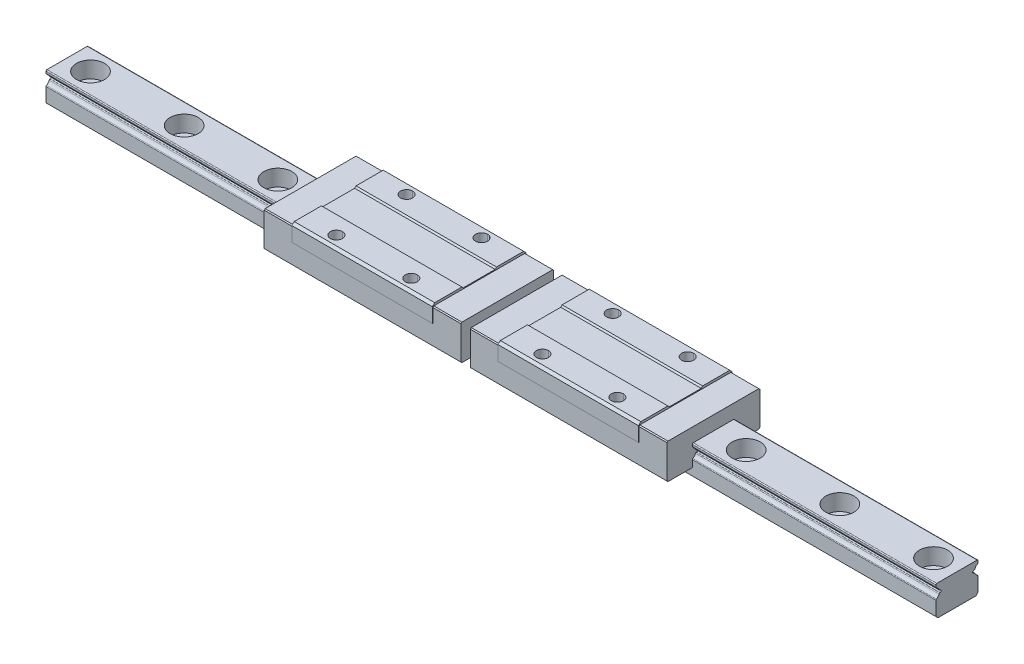
from build123d import *

# Parameters (mm, degrees)
SKETCH_1_W                   = 190
SKETCH_1_H                   = 9
EXTRUDE_1_DEPTH              = 6.5
CUT_EXTRUDE_1_DEPTH          = 191.081068231
CUT_EXTRUDE_2_DEPTH          = 191.081068231
CUT_EXTRUDE_3_DEPTH          = 191.081068231
CUT_EXTRUDE_4_DEPTH          = 191.081068231
CUT_EXTRUDE_5_DEPTH          = 191.081068231
CUT_EXTRUDE_6_DEPTH          = 191.081068231
HOLE_WIZARD_M3_1_D           = 3.5
HOLE_WIZARD_M3_1_CBORE_D     = 5.9999
HOLE_WIZARD_M3_1_CBORE_DEPTH = 3.5
CHAMFER_1_SIZE               = 0.45
FILLET_1_R                   = 0.2
MOVE_START                   = -28.71
MOVE_BODY_1_DEPTH            = 13.42
MOVE_START_2                 = -43
MOVE_BODY_1_2_DEPTH          = 11.71
MOVE_START_3                 = -12.71
MOVE_BODY_1_3_DEPTH          = 11.71
MOVE_START_4                 = -37
MOVE_BODY_1_4_DEPTH          = 5.71
MOVE_BODY_1_5_DEPTH          = 5.71
MOVE_BODY_1_6_DEPTH          = 30
MOVE_START_5                 = -31.29
MOVE_BODY_1_7_DEPTH          = 18.58


with BuildPart() as part:
    # 草图1 → 凸台-拉伸1 (new body)
    with BuildSketch(Plane(origin=(0, 3.25, 0), x_dir=(1, 0, 0), z_dir=(0, 1, 0))):
        Rectangle(SKETCH_1_W, SKETCH_1_H)
    extrude(amount=-EXTRUDE_1_DEPTH)

    # 草图2 → 切除-拉伸1 (cut, through all)
    with BuildSketch(Plane(origin=(95, 0, 0), x_dir=(0, 0, -1), z_dir=(1, 0, 0))):
        with BuildLine():
            Line((4.5, 1.18), (4.5, 1.68))
            Line((4.5, 1.68), (3.6, 1.68))
            ThreePointArc((3.6, 1.68), (3.35, 1.43), (3.6, 1.18))
            Line((3.6, 1.18), (4.5, 1.18))
        make_face()
    extrude(amount=-CUT_EXTRUDE_1_DEPTH, mode=Mode.SUBTRACT)

    # 草图3 → 切除-拉伸2 (cut, through all)
    with BuildSketch(Plane(origin=(95, 0, 0), x_dir=(0, 0, -1), z_dir=(1, 0, 0))):
        with BuildLine():
            Line((4.5, 1.68), (4.5, 2.527778))
            ThreePointArc((4.5, 2.527778), (4.033873637, 2.194019885), (3.78, 1.68))
            Line((3.78, 1.68), (4.5, 1.68))
        make_face()
    extrude(amount=-CUT_EXTRUDE_2_DEPTH, mode=Mode.SUBTRACT)

    # 草图4 → 切除-拉伸3 (cut, through all)
    with BuildSketch(Plane(origin=(95, 0, 0), x_dir=(0, 0, -1), z_dir=(1, 0, 0))):
        with BuildLine():
            Line((4.5, 1.18), (3.78, 1.18))
            ThreePointArc((3.78, 1.18), (4.033873637, 0.665980115), (4.5, 0.332222))
            Line((4.5, 0.332222), (4.5, 1.18))
        make_face()
    extrude(amount=-CUT_EXTRUDE_3_DEPTH, mode=Mode.SUBTRACT)

    # 草图5 → 切除-拉伸4 (cut, through all)
    with BuildSketch(Plane(origin=(95, 0, 0), x_dir=(0, 0, -1), z_dir=(1, 0, 0))):
        with BuildLine():
            Line((-4.5, 1.68), (-4.5, 1.18))
            Line((-4.5, 1.18), (-3.6, 1.18))
            ThreePointArc((-3.6, 1.18), (-3.35, 1.43), (-3.6, 1.68))
            Line((-3.6, 1.68), (-4.5, 1.68))
        make_face()
    extrude(amount=-CUT_EXTRUDE_4_DEPTH, mode=Mode.SUBTRACT)

    # 草图6 → 切除-拉伸5 (cut, through all)
    with BuildSketch(Plane(origin=(95, 0, 0), x_dir=(0, 0, -1), z_dir=(1, 0, 0))):
        with BuildLine():
            Line((-4.5, 1.18), (-4.5, 0.332222))
            ThreePointArc((-4.5, 0.332222), (-4.033873637, 0.665980115), (-3.78, 1.18))
            Line((-3.78, 1.18), (-4.5, 1.18))
        make_face()
    extrude(amount=-CUT_EXTRUDE_5_DEPTH, mode=Mode.SUBTRACT)

    # 草图7 → 切除-拉伸6 (cut, through all)
    with BuildSketch(Plane(origin=(95, 0, 0), x_dir=(0, 0, -1), z_dir=(1, 0, 0))):
        with BuildLine():
            Line((-4.5, 1.68), (-3.78, 1.68))
            ThreePointArc((-3.78, 1.68), (-4.033873637, 2.194019885), (-4.5, 2.527778))
            Line((-4.5, 2.527778), (-4.5, 1.68))
        make_face()
    extrude(amount=-CUT_EXTRUDE_6_DEPTH, mode=Mode.SUBTRACT)

    # M3 六角头机械螺钉的柱形沉头孔1 (through all)
    with Locations(Plane(origin=(0, 3.25, 0), x_dir=(1, 0, 0), z_dir=(0, 1, 0))):
        with Locations((-90, 0), (-70, 0), (-50, 0), (-30, 0), (-10, 0), (10, 0), (30, 0), (50, 0), (70, 0), (90, 0)):
            CounterBoreHole(HOLE_WIZARD_M3_1_D / 2, HOLE_WIZARD_M3_1_CBORE_D / 2, HOLE_WIZARD_M3_1_CBORE_DEPTH)

    # 倒角1
    chamfer_1_edges = [part.edges().sort_by_distance(p)[0] for p in [
        (0, -3.25, -4.5),
        (0, -3.25, 4.5),
    ]]
    chamfer(chamfer_1_edges, length=CHAMFER_1_SIZE)

    # 圆角1
    fillet_1_edges = [part.edges().sort_by_distance(p)[0] for p in [
        (0, 1.68, -3.78),
        (0, 2.527778, -4.5),
        (0, 0.332222, -4.5),
        (0, 1.18, -3.78),
        (0, 3.25, -4.5),
        (0, 3.25, 4.5),
        (0, 1.18, 3.78),
        (0, 0.332222, 4.5),
        (0, 2.527778, 4.5),
        (0, 1.68, 3.78),
    ]]
    fillet(fillet_1_edges, radius=FILLET_1_R)


with BuildPart() as body_2:
    # Move Body 1: read off the stored shape, not the designer's step
    # Move Body 1 outline → Move Body 1 (new body)
    with BuildSketch(Plane.YZ.offset(MOVE_START)):
        with BuildLine():
            Line((2.656307024, 4.5), (2.95, 4.5))
            ThreePointArc((2.95, 4.5), (3.162132034, 4.412132034), (3.25, 4.2))
            Line((3.25, 4.2), (3.25, -4.2))
            ThreePointArc((3.25, -4.2), (3.162132034, -4.412132034), (2.95, -4.5))
            Line((2.95, -4.5), (2.656307024, -4.5))
            ThreePointArc((2.656307024, -4.5), (2.552283771, -4.470819094), (2.478615446, -4.391791629))
            ThreePointArc((2.478615446, -4.391791629), (2.202049035, -4.040754773), (1.814795114, -3.817707124))
            ThreePointArc((1.814795114, -3.817707124), (1.717148876, -3.744736153), (1.68, -3.628634855))
            Line((1.68, -3.628634855), (1.68, -3.6))
            ThreePointArc((1.68, -3.6), (1.606776695, -3.423223305), (1.43, -3.35))
            ThreePointArc((1.43, -3.35), (1.253223305, -3.423223305), (1.18, -3.6))
            Line((1.18, -3.6), (1.18, -3.628634855))
            ThreePointArc((1.18, -3.628634855), (1.142851124, -3.744736153), (1.045204886, -3.817707124))
            ThreePointArc((1.045204886, -3.817707124), (0.657950965, -4.040754773), (0.381384554, -4.391791629))
            ThreePointArc((0.381384554, -4.391791629), (0.307716229, -4.470819094), (0.203692976, -4.5))
            Line((0.203692976, -4.5), (-1.25, -4.5))
            Line((-1.25, -4.5), (-1.25, -9.7))
            Line((-1.25, -9.7), (-1.05, -9.9))
            Line((-1.05, -9.9), (3.05, -9.9))
            Line((3.05, -9.9), (3.15, -10))
            Line((3.15, -10), (4.455051026, -10))
            ThreePointArc((4.455051026, -10), (4.7, -9.9), (4.944948974, -10))
            Line((4.944948974, -10), (6.25, -10))
            Line((6.25, -10), (6.75, -9.5))
            Line((6.75, -9.5), (6.75, -3.7))
            Line((6.75, -3.7), (6.45, -3.4))
            Line((6.45, -3.4), (6.45, 3.4))
            Line((6.45, 3.4), (6.75, 3.7))
            Line((6.75, 3.7), (6.75, 9.5))
            Line((6.75, 9.5), (6.25, 10))
            Line((6.25, 10), (3.15, 10))
            Line((3.15, 10), (3.05, 9.9))
            Line((3.05, 9.9), (-1.05, 9.9))
            Line((-1.05, 9.9), (-1.25, 9.7))
            Line((-1.25, 9.7), (-1.25, 4.5))
            Line((-1.25, 4.5), (0.203692976, 4.5))
            ThreePointArc((0.203692976, 4.5), (0.307716229, 4.470819094), (0.381384554, 4.391791629))
            ThreePointArc((0.381384554, 4.391791629), (0.657950965, 4.040754773), (1.045204886, 3.817707124))
            ThreePointArc((1.045204886, 3.817707124), (1.142851124, 3.744736153), (1.18, 3.628634855))
            Line((1.18, 3.628634855), (1.18, 3.6))
            ThreePointArc((1.18, 3.6), (1.43, 3.35), (1.68, 3.6))
            Line((1.68, 3.6), (1.68, 3.628634855))
            ThreePointArc((1.68, 3.628634855), (1.717148876, 3.744736153), (1.814795114, 3.817707124))
            ThreePointArc((1.814795114, 3.817707124), (2.202049035, 4.040754773), (2.478615446, 4.391791629))
            ThreePointArc((2.478615446, 4.391791629), (2.552283771, 4.470819094), (2.656307024, 4.5))
        make_face()
    extrude(amount=MOVE_BODY_1_DEPTH)

    # Move Body 1 2 outline → Move Body 1 2 (add)
    with BuildSketch(Plane.YZ.offset(MOVE_START_2)):
        with BuildLine():
            Line((2.656307024, 4.5), (2.95, 4.5))
            ThreePointArc((2.95, 4.5), (3.162132034, 4.412132034), (3.25, 4.2))
            Line((3.25, 4.2), (3.25, -4.2))
            ThreePointArc((3.25, -4.2), (3.162132034, -4.412132034), (2.95, -4.5))
            Line((2.95, -4.5), (2.656307024, -4.5))
            ThreePointArc((2.656307024, -4.5), (2.552283771, -4.470819094), (2.478615446, -4.391791629))
            ThreePointArc((2.478615446, -4.391791629), (2.202049035, -4.040754773), (1.814795114, -3.817707124))
            ThreePointArc((1.814795114, -3.817707124), (1.717148876, -3.744736153), (1.68, -3.628634855))
            Line((1.68, -3.628634855), (1.68, -3.6))
            ThreePointArc((1.68, -3.6), (1.606776695, -3.423223305), (1.43, -3.35))
            ThreePointArc((1.43, -3.35), (1.253223305, -3.423223305), (1.18, -3.6))
            Line((1.18, -3.6), (1.18, -3.628634855))
            ThreePointArc((1.18, -3.628634855), (1.142851124, -3.744736153), (1.045204886, -3.817707124))
            ThreePointArc((1.045204886, -3.817707124), (0.657950965, -4.040754773), (0.381384554, -4.391791629))
            ThreePointArc((0.381384554, -4.391791629), (0.307716229, -4.470819094), (0.203692976, -4.5))
            Line((0.203692976, -4.5), (-1.25, -4.5))
            Line((-1.25, -4.5), (-1.25, -9.7))
            Line((-1.25, -9.7), (-1.05, -9.9))
            Line((-1.05, -9.9), (6.05, -9.9))
            Line((6.05, -9.9), (6.25, -9.7))
            Line((6.25, -9.7), (6.25, 9.7))
            Line((6.25, 9.7), (6.05, 9.9))
            Line((6.05, 9.9), (-1.05, 9.9))
            Line((-1.05, 9.9), (-1.25, 9.7))
            Line((-1.25, 9.7), (-1.25, 4.5))
            Line((-1.25, 4.5), (0.203692976, 4.5))
            ThreePointArc((0.203692976, 4.5), (0.307716229, 4.470819094), (0.381384554, 4.391791629))
            ThreePointArc((0.381384554, 4.391791629), (0.657950965, 4.040754773), (1.045204886, 3.817707124))
            ThreePointArc((1.045204886, 3.817707124), (1.142851124, 3.744736153), (1.18, 3.628634855))
            Line((1.18, 3.628634855), (1.18, 3.6))
            ThreePointArc((1.18, 3.6), (1.43, 3.35), (1.68, 3.6))
            Line((1.68, 3.6), (1.68, 3.628634855))
            ThreePointArc((1.68, 3.628634855), (1.717148876, 3.744736153), (1.814795114, 3.817707124))
            ThreePointArc((1.814795114, 3.817707124), (2.202049035, 4.040754773), (2.478615446, 4.391791629))
            ThreePointArc((2.478615446, 4.391791629), (2.552283771, 4.470819094), (2.656307024, 4.5))
        make_face()
    extrude(amount=MOVE_BODY_1_2_DEPTH)

    # Move Body 1 3 outline → Move Body 1 3 (add)
    with BuildSketch(Plane.YZ.offset(MOVE_START_3)):
        with BuildLine():
            Line((2.656307024, 4.5), (2.95, 4.5))
            ThreePointArc((2.95, 4.5), (3.162132034, 4.412132034), (3.25, 4.2))
            Line((3.25, 4.2), (3.25, -4.2))
            ThreePointArc((3.25, -4.2), (3.162132034, -4.412132034), (2.95, -4.5))
            Line((2.95, -4.5), (2.656307024, -4.5))
            ThreePointArc((2.656307024, -4.5), (2.552283771, -4.470819094), (2.478615446, -4.391791629))
            ThreePointArc((2.478615446, -4.391791629), (2.202049035, -4.040754773), (1.814795114, -3.817707124))
            ThreePointArc((1.814795114, -3.817707124), (1.717148876, -3.744736153), (1.68, -3.628634855))
            Line((1.68, -3.628634855), (1.68, -3.6))
            ThreePointArc((1.68, -3.6), (1.606776695, -3.423223305), (1.43, -3.35))
            ThreePointArc((1.43, -3.35), (1.253223305, -3.423223305), (1.18, -3.6))
            Line((1.18, -3.6), (1.18, -3.628634855))
            ThreePointArc((1.18, -3.628634855), (1.142851124, -3.744736153), (1.045204886, -3.817707124))
            ThreePointArc((1.045204886, -3.817707124), (0.657950965, -4.040754773), (0.381384554, -4.391791629))
            ThreePointArc((0.381384554, -4.391791629), (0.307716229, -4.470819094), (0.203692976, -4.5))
            Line((0.203692976, -4.5), (-1.25, -4.5))
            Line((-1.25, -4.5), (-1.25, -9.7))
            Line((-1.25, -9.7), (-1.05, -9.9))
            Line((-1.05, -9.9), (6.05, -9.9))
            Line((6.05, -9.9), (6.25, -9.7))
            Line((6.25, -9.7), (6.25, 9.7))
            Line((6.25, 9.7), (6.05, 9.9))
            Line((6.05, 9.9), (-1.05, 9.9))
            Line((-1.05, 9.9), (-1.25, 9.7))
            Line((-1.25, 9.7), (-1.25, 4.5))
            Line((-1.25, 4.5), (0.203692976, 4.5))
            ThreePointArc((0.203692976, 4.5), (0.307716229, 4.470819094), (0.381384554, 4.391791629))
            ThreePointArc((0.381384554, 4.391791629), (0.657950965, 4.040754773), (1.045204886, 3.817707124))
            ThreePointArc((1.045204886, 3.817707124), (1.142851124, 3.744736153), (1.18, 3.628634855))
            Line((1.18, 3.628634855), (1.18, 3.6))
            ThreePointArc((1.18, 3.6), (1.43, 3.35), (1.68, 3.6))
            Line((1.68, 3.6), (1.68, 3.628634855))
            ThreePointArc((1.68, 3.628634855), (1.717148876, 3.744736153), (1.814795114, 3.817707124))
            ThreePointArc((1.814795114, 3.817707124), (2.202049035, 4.040754773), (2.478615446, 4.391791629))
            ThreePointArc((2.478615446, 4.391791629), (2.552283771, 4.470819094), (2.656307024, 4.5))
        make_face()
    extrude(amount=MOVE_BODY_1_3_DEPTH)

    # Move Body 1 4 outline → Move Body 1 4 (add)
    with BuildSketch(Plane.YZ.offset(MOVE_START_4)):
        with BuildLine():
            Line((3.15, 10), (3.05, 9.9))
            Line((3.05, 9.9), (6.05, 9.9))
            Line((6.05, 9.9), (6.25, 9.7))
            Line((6.25, 9.7), (6.25, -9.7))
            Line((6.25, -9.7), (6.05, -9.9))
            Line((6.05, -9.9), (4.7, -9.9))
            ThreePointArc((4.7, -9.9), (4.832287565, -9.925962965), (4.944948974, -10))
            Line((4.944948974, -10), (6.25, -10))
            Line((6.25, -10), (6.75, -9.5))
            Line((6.75, -9.5), (6.75, -3.7))
            Line((6.75, -3.7), (6.45, -3.4))
            Line((6.45, -3.4), (6.45, 3.4))
            Line((6.45, 3.4), (6.75, 3.7))
            Line((6.75, 3.7), (6.75, 9.5))
            Line((6.75, 9.5), (6.25, 10))
            Line((6.25, 10), (3.15, 10))
        make_face()
        with BuildLine():
            Line((4.7, -9.9), (3.05, -9.9))
            Line((3.05, -9.9), (3.15, -10))
            Line((3.15, -10), (4.455051026, -10))
            ThreePointArc((4.455051026, -10), (4.567712435, -9.925962965), (4.7, -9.9))
        make_face()
    extrude(amount=MOVE_BODY_1_4_DEPTH)

    # Move Body 1 5 outline → Move Body 1 5 (add)
    with BuildSketch(Plane.YZ.offset(MOVE_START_3)):
        with BuildLine():
            Line((3.15, 10), (3.05, 9.9))
            Line((3.05, 9.9), (6.05, 9.9))
            Line((6.05, 9.9), (6.25, 9.7))
            Line((6.25, 9.7), (6.25, -9.7))
            Line((6.25, -9.7), (6.05, -9.9))
            Line((6.05, -9.9), (4.7, -9.9))
            ThreePointArc((4.7, -9.9), (4.832287565, -9.925962965), (4.944948974, -10))
            Line((4.944948974, -10), (6.25, -10))
            Line((6.25, -10), (6.75, -9.5))
            Line((6.75, -9.5), (6.75, -3.7))
            Line((6.75, -3.7), (6.45, -3.4))
            Line((6.45, -3.4), (6.45, 3.4))
            Line((6.45, 3.4), (6.75, 3.7))
            Line((6.75, 3.7), (6.75, 9.5))
            Line((6.75, 9.5), (6.25, 10))
            Line((6.25, 10), (3.15, 10))
        make_face()
        with BuildLine():
            Line((4.7, -9.9), (3.05, -9.9))
            Line((3.05, -9.9), (3.15, -10))
            Line((3.15, -10), (4.455051026, -10))
            ThreePointArc((4.455051026, -10), (4.567712435, -9.925962965), (4.7, -9.9))
        make_face()
    extrude(amount=MOVE_BODY_1_5_DEPTH)

    # Move Body 1 6 outline → Move Body 1 6 (add)
    with BuildSketch(Plane.YZ.offset(MOVE_START_4)):
        with BuildLine():
            Line((4.7, -9.9), (3.05, -9.9))
            Line((3.05, -9.9), (3.15, -10))
            Line((3.15, -10), (4.455051026, -10))
            ThreePointArc((4.455051026, -10), (4.567712435, -9.925962965), (4.7, -9.9))
        make_face()
    extrude(amount=MOVE_BODY_1_6_DEPTH)

    # Move Body 1 7 outline → Move Body 1 7 (add)
    with BuildSketch(Plane.YZ.offset(MOVE_START_5)):
        with BuildLine():
            Line((2.656307024, 4.5), (2.95, 4.5))
            ThreePointArc((2.95, 4.5), (3.162132034, 4.412132034), (3.25, 4.2))
            Line((3.25, 4.2), (3.25, -4.2))
            ThreePointArc((3.25, -4.2), (3.162132034, -4.412132034), (2.95, -4.5))
            Line((2.95, -4.5), (2.656307024, -4.5))
            ThreePointArc((2.656307024, -4.5), (2.552283771, -4.470819094), (2.478615446, -4.391791629))
            ThreePointArc((2.478615446, -4.391791629), (2.202049035, -4.040754773), (1.814795114, -3.817707124))
            ThreePointArc((1.814795114, -3.817707124), (1.717148876, -3.744736153), (1.68, -3.628634855))
            Line((1.68, -3.628634855), (1.68, -3.6))
            ThreePointArc((1.68, -3.6), (1.606776695, -3.423223305), (1.43, -3.35))
            ThreePointArc((1.43, -3.35), (1.253223305, -3.423223305), (1.18, -3.6))
            Line((1.18, -3.6), (1.18, -3.628634855))
            ThreePointArc((1.18, -3.628634855), (1.142851124, -3.744736153), (1.045204886, -3.817707124))
            ThreePointArc((1.045204886, -3.817707124), (0.657950965, -4.040754773), (0.381384554, -4.391791629))
            ThreePointArc((0.381384554, -4.391791629), (0.307716229, -4.470819094), (0.203692976, -4.5))
            Line((0.203692976, -4.5), (-1.25, -4.5))
            Line((-1.25, -4.5), (-1.25, -9.7))
            Line((-1.25, -9.7), (-1.05, -9.9))
            Line((-1.05, -9.9), (4.7, -9.9))
            ThreePointArc((4.7, -9.9), (4.832287565, -9.925962965), (4.944948974, -10))
            Line((4.944948974, -10), (6.25, -10))
            Line((6.25, -10), (6.75, -9.5))
            Line((6.75, -9.5), (6.75, -3.7))
            Line((6.75, -3.7), (6.45, -3.4))
            Line((6.45, -3.4), (6.45, 3.4))
            Line((6.45, 3.4), (6.75, 3.7))
            Line((6.75, 3.7), (6.75, 9.5))
            Line((6.75, 9.5), (6.25, 10))
            Line((6.25, 10), (3.15, 10))
            Line((3.15, 10), (3.05, 9.9))
            Line((3.05, 9.9), (-1.05, 9.9))
            Line((-1.05, 9.9), (-1.25, 9.7))
            Line((-1.25, 9.7), (-1.25, 4.5))
            Line((-1.25, 4.5), (0.203692976, 4.5))
            ThreePointArc((0.203692976, 4.5), (0.307716229, 4.470819094), (0.381384554, 4.391791629))
            ThreePointArc((0.381384554, 4.391791629), (0.657950965, 4.040754773), (1.045204886, 3.817707124))
            ThreePointArc((1.045204886, 3.817707124), (1.142851124, 3.744736153), (1.18, 3.628634855))
            Line((1.18, 3.628634855), (1.18, 3.6))
            ThreePointArc((1.18, 3.6), (1.43, 3.35), (1.68, 3.6))
            Line((1.68, 3.6), (1.68, 3.628634855))
            ThreePointArc((1.68, 3.628634855), (1.717148876, 3.744736153), (1.814795114, 3.817707124))
            ThreePointArc((1.814795114, 3.817707124), (2.202049035, 4.040754773), (2.478615446, 4.391791629))
            ThreePointArc((2.478615446, 4.391791629), (2.552283771, 4.470819094), (2.656307024, 4.5))
        make_face()
    extrude(amount=MOVE_BODY_1_7_DEPTH)

    # Move Body 1 8 outline → Move Body 1 8 (revolve, cut)
    with BuildSketch(Plane(origin=(-30, 0, 7.5), x_dir=(1, 0, 0), z_dir=(0, 0, 1))):
        Polygon((0, 6.75), (0, 2.974889801), (1.29, 3.75), (1.29, 6.75), align=None)
    revolve(axis=Axis((-30, 0, 7.5), (0, 1, 0)), mode=Mode.SUBTRACT)

    # Move Body 1 9 outline → Move Body 1 9 (revolve, cut)
    with BuildSketch(Plane(origin=(-14, 0, 7.5), x_dir=(1, 0, 0), z_dir=(0, 0, 1))):
        Polygon((0, 6.75), (0, 2.974889801), (1.29, 3.75), (1.29, 6.75), align=None)
    revolve(axis=Axis((-14, 0, 7.5), (0, 1, 0)), mode=Mode.SUBTRACT)

    # Move Body 1 10 outline → Move Body 1 10 (revolve, cut)
    with BuildSketch(Plane(origin=(-14, 0, -7.5), x_dir=(1, 0, 0), z_dir=(0, 0, 1))):
        Polygon((0, 6.75), (0, 2.974889801), (1.29, 3.75), (1.29, 6.75), align=None)
    revolve(axis=Axis((-14, 0, -7.5), (0, 1, 0)), mode=Mode.SUBTRACT)

    # Move Body 1 11 outline → Move Body 1 11 (revolve, cut)
    with BuildSketch(Plane(origin=(-30, 0, -7.5), x_dir=(1, 0, 0), z_dir=(0, 0, 1))):
        Polygon((0, 6.75), (0, 2.974889801), (1.29, 3.75), (1.29, 6.75), align=None)
    revolve(axis=Axis((-30, 0, -7.5), (0, 1, 0)), mode=Mode.SUBTRACT)


with BuildPart() as body_3:
    # Move Body 2: read off the stored shape, not the designer's step
    # Move Body 2: copy of body 2
    add(body_2.part.moved(Location((44, 0, 0))))


solid = Compound([part.part, body_2.part, body_3.part])
